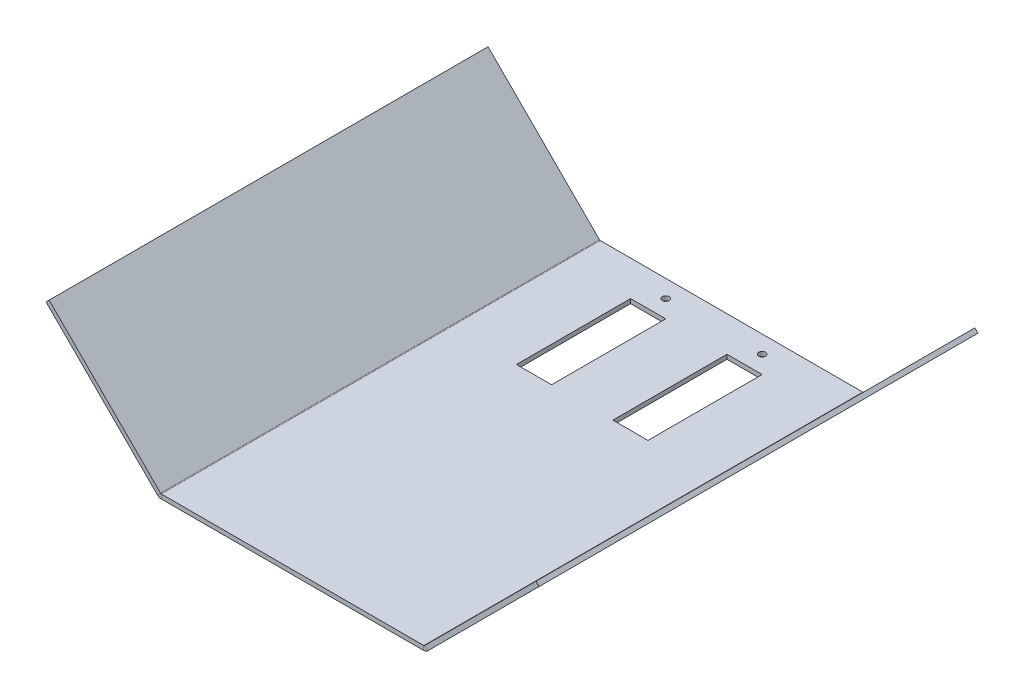
from build123d import *

# Parameters (mm, degrees)
BASE_FLANGE1_DEPTH = 158.75
SKETCH8_R          = 2.4892
SKETCH8_W          = 25.4
SKETCH8_H          = 82.55
CUT_EXTRUDE1_DEPTH = 327.455070335
CUT_EXTRUDE3_START = 134.703841816
CUT_EXTRUDE3_DEPTH = 3.175


# Read off the part's stored shape, not the designer's step: Cut-Extrude3
# Sheet-metal steps are written as plain solids
with BuildPart() as part:
    # Sketch1 → Base-Flange1 (new, symmetric)
    with BuildSketch(Plane.XY):
        with BuildLine():
            Line((-80.82230509, 80.82230509), (-0.238063608, 0.238063608))
            ThreePointArc((-0.238063608, 0.238063608), (0.02562769, 0.061870716), (0.336672783, 0))
            Line((0.336672783, 0), (190.163327217, 0))
            ThreePointArc((190.163327217, 0), (190.47437231, 0.061870716), (190.738063608, 0.238063608))
            Line((190.738063608, 0.238063608), (271.32230509, 80.82230509))
            Line((271.32230509, 80.82230509), (273.56736912, 78.577241059))
            Line((273.56736912, 78.577241059), (192.983127639, -2.007000422))
            ThreePointArc((192.983127639, -2.007000422), (191.689392208, -2.8714468), (190.163327217, -3.175))
            Line((190.163327217, -3.175), (0.336672783, -3.175))
            ThreePointArc((0.336672783, -3.175), (-1.189392208, -2.8714468), (-2.483127639, -2.007000422))
            Line((-2.483127639, -2.007000422), (-83.06736912, 78.577241059))
            Line((-83.06736912, 78.577241059), (-80.82230509, 80.82230509))
        make_face()
    extrude(amount=BASE_FLANGE1_DEPTH, both=True)

    # Sketch8 → Cut-Extrude1 (cut, through all)
    with BuildSketch(Plane(origin=(0, 0, 0), x_dir=(1, 0, 0), z_dir=(0, 1, 0))):
        with Locations(Location((60.3885, 146.05, 0), (0, 0, 270))):
            Circle(SKETCH8_R)
        with Locations(Location((130.1115, 146.05, 0), (0, 0, 270))):
            Circle(SKETCH8_R)
        with Locations((60.3885, 92.075)):
            Rectangle(SKETCH8_W, SKETCH8_H)
        with Locations((130.1115, 92.075)):
            Rectangle(SKETCH8_W, SKETCH8_H)
    extrude(amount=-CUT_EXTRUDE1_DEPTH, mode=Mode.SUBTRACT)

    # Cut-Extrude3 outline → Cut-Extrude3 (cut)
    with BuildSketch(Plane(origin=(0, 0, 0), x_dir=(0.7071067811865472, 0.7071067811865479, 0), z_dir=(0.7071067811865479, -0.707106781186547, 0)).offset(CUT_EXTRUDE3_START)):
        with BuildLine():
            add(Edge.make_bspline(
                [(151.754493433, -150.8125), (145.019301342, -150.8125), (145.019301342, -146.05), (145.019301342, -141.2875), (151.754493433, -141.2875)],
                knots=[4.71238898, 4.71238898, 4.71238898, 6.283185307, 6.283185307, 7.853981634, 7.853981634, 7.853981634], degree=2, weights=[1, 0.707106781, 1, 0.707106781, 1]))
            Line((151.754493433, -150.8125), (154.929493433, -150.8125))
            add(Edge.make_bspline(
                [(154.929493433, -141.2875), (161.664685524, -141.2875), (161.664685524, -146.05), (161.664685524, -150.8125), (154.929493433, -150.8125)],
                knots=[1.570796327, 1.570796327, 1.570796327, 3.141592654, 3.141592654, 4.71238898, 4.71238898, 4.71238898], degree=2, weights=[1, 0.707106781, 1, 0.707106781, 1]))
            Line((154.929493433, -141.2875), (151.754493433, -141.2875))
        make_face()
    extrude(amount=CUT_EXTRUDE3_DEPTH, mode=Mode.SUBTRACT)


solid = part.part
